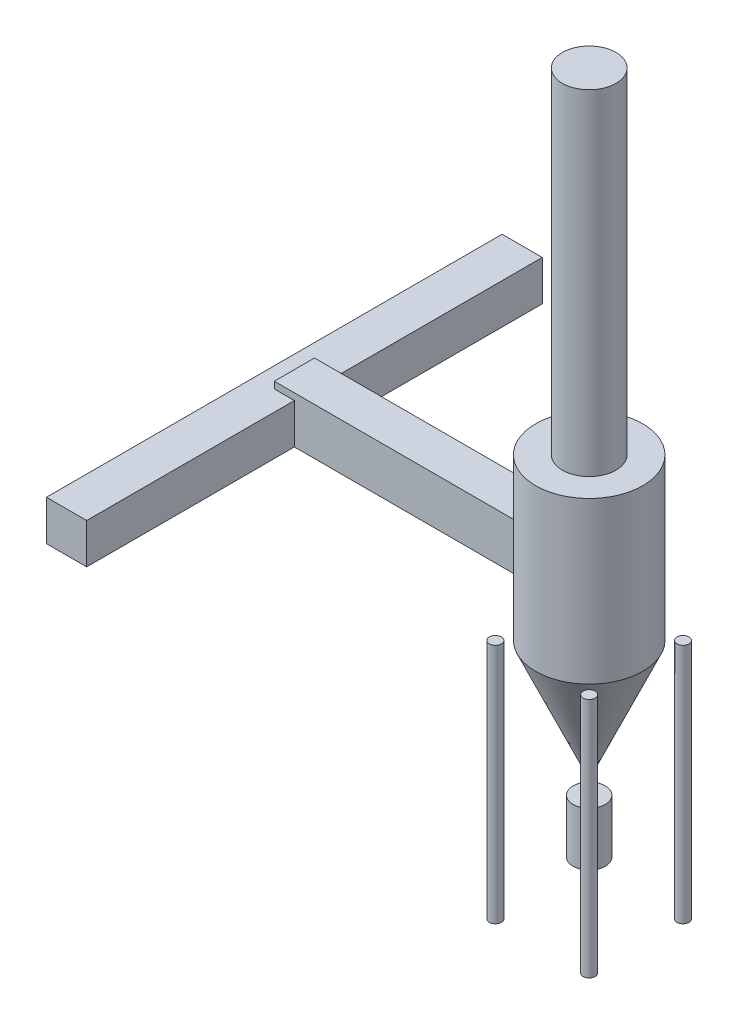
from build123d import *

# Parameters (mm, degrees)
SKETCH1_R            = 45
BOSS_EXTRUDE1_DEPTH  = 1800
SKETCH2_R            = 45
BOSS_EXTRUDE2_DEPTH  = 1800
SKETCH3_R            = 45
BOSS_EXTRUDE3_DEPTH  = 1800
SKETCH4_R            = 45
BOSS_EXTRUDE4_DEPTH  = 1800
BOSS_EXTRUDE5_START  = 400
SKETCH5_R            = 120
BOSS_EXTRUDE5_DEPTH  = 400
BOSS_EXTRUDE7_START  = 1800
SKETCH7_R            = 400
BOSS_EXTRUDE7_DEPTH  = 1200
BOSS_EXTRUDE8_START  = 3000
SKETCH8_R            = 200
BOSS_EXTRUDE8_DEPTH  = 2500
BOSS_EXTRUDE9_START  = 2100
SKETCH9_W            = 300
SKETCH9_H            = 3400
BOSS_EXTRUDE9_DEPTH  = 300
BOSS_EXTRUDE10_START = 2100
SKETCH10_W           = 1800
SKETCH10_H           = 300
BOSS_EXTRUDE10_DEPTH = 350


with BuildPart() as part:
    # Sketch1 → Boss-Extrude1 (new body)
    with BuildSketch(Plane(origin=(0, 0, 0), x_dir=(1, 0, 0), z_dir=(0, 1, 0))):
        with Locations((1850, 5150)):
            Circle(SKETCH1_R)
    extrude(amount=BOSS_EXTRUDE1_DEPTH)


with BuildPart() as body_2:
    # Sketch2 → Boss-Extrude2 (new body)
    with BuildSketch(Plane(origin=(0, 0, 0), x_dir=(1, 0, 0), z_dir=(0, 1, 0))):
        with Locations((2550, 5150)):
            Circle(SKETCH2_R)
    extrude(amount=BOSS_EXTRUDE2_DEPTH)


with BuildPart() as body_3:
    # Sketch3 → Boss-Extrude3 (new body)
    with BuildSketch(Plane(origin=(0, 0, 0), x_dir=(1, 0, 0), z_dir=(0, 1, 0))):
        with Locations((1850, 5850)):
            Circle(SKETCH3_R)
    extrude(amount=BOSS_EXTRUDE3_DEPTH)


with BuildPart() as body_4:
    # Sketch4 → Boss-Extrude4 (new body)
    with BuildSketch(Plane(origin=(0, 0, 0), x_dir=(1, 0, 0), z_dir=(0, 1, 0))):
        with Locations((2550, 5850)):
            Circle(SKETCH4_R)
    extrude(amount=BOSS_EXTRUDE4_DEPTH)


with BuildPart() as body_5:
    # Sketch5 → Boss-Extrude5 (new body)
    with BuildSketch(Plane(origin=(0, 0, 0), x_dir=(1, 0, 0), z_dir=(0, 1, 0)).offset(BOSS_EXTRUDE5_START)):
        with Locations((2200, 5500)):
            Circle(SKETCH5_R)
    extrude(amount=BOSS_EXTRUDE5_DEPTH)


with BuildPart() as body_6:
    # Boss-Extrude6 cone 1 section (through the dimple's axis) → Boss-Extrude6 (revolve)
    with BuildSketch(Plane(origin=(2200, 1800, -5500), x_dir=(0, 0, 1), z_dir=(1, 0, 0))):
        Polygon((0, 0), (400, 0), (0, 898.414709562), align=None)
    revolve(axis=Axis((2200, 1800, -5500), (0, -1, 0)))

    # Sketch7 → Boss-Extrude7 (add)
    with BuildSketch(Plane(origin=(0, 0, 0), x_dir=(1, 0, 0), z_dir=(0, 1, 0)).offset(BOSS_EXTRUDE7_START)):
        with Locations((2200, 5500)):
            Circle(SKETCH7_R)
    extrude(amount=BOSS_EXTRUDE7_DEPTH)

    # Sketch8 → Boss-Extrude8 (add)
    with BuildSketch(Plane(origin=(0, 0, 0), x_dir=(1, 0, 0), z_dir=(0, 1, 0)).offset(BOSS_EXTRUDE8_START)):
        with Locations((2200, 5500)):
            Circle(SKETCH8_R)
    extrude(amount=BOSS_EXTRUDE8_DEPTH)


with BuildPart() as body_7:
    # Sketch9 → Boss-Extrude9 (new body)
    with BuildSketch(Plane(origin=(0, 0, 0), x_dir=(1, 0, 0), z_dir=(0, 1, 0)).offset(BOSS_EXTRUDE9_START)):
        with Locations((0, 5500)):
            Rectangle(SKETCH9_W, SKETCH9_H)
    extrude(amount=BOSS_EXTRUDE9_DEPTH)

    # Sketch10 → Boss-Extrude10 (add)
    with BuildSketch(Plane(origin=(0, 0, 0), x_dir=(1, 0, 0), z_dir=(0, 1, 0)).offset(BOSS_EXTRUDE10_START)):
        with Locations((900, 5500)):
            Rectangle(SKETCH10_W, SKETCH10_H)
    extrude(amount=BOSS_EXTRUDE10_DEPTH)


solid = Compound([part.part, body_2.part, body_3.part, body_4.part, body_5.part, body_6.part, body_7.part])
